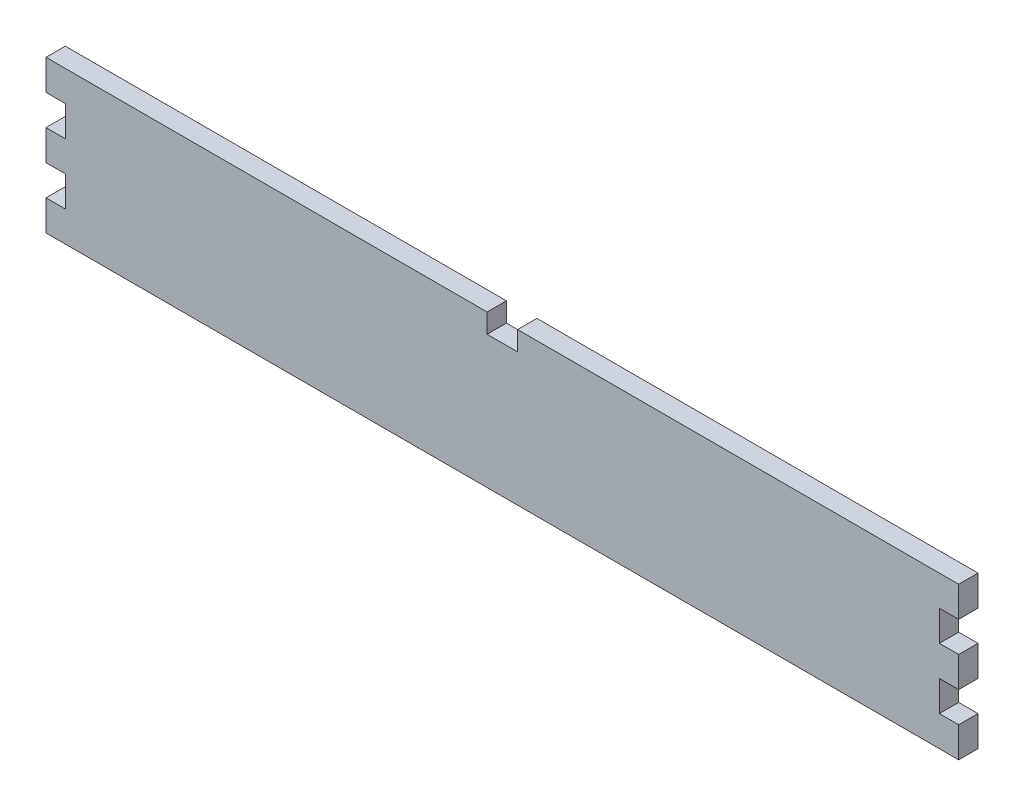
from build123d import *

# Parameters (mm, degrees)
BOSS_EXTRUDE1_OUTLINE_W = 50
BOSS_EXTRUDE1_OUTLINE_H = 6.35
BOSS_EXTRUDE1_DEPTH     = 300
SKETCH1_W               = 10
SKETCH1_H               = 6.35
F_250_TOOTH_DEPTH       = 305.204409074
SKETCH5_W               = 6.35
SKETCH5_H               = 10
F_3T_CUT_DEPTH          = 305.204409074


# Read off the part's stored shape, not the designer's step: Boss-Extrude1
with BuildPart() as part:
    # Boss-Extrude1 outline → Boss-Extrude1 (new body)
    with BuildSketch(Plane.YZ):
        with Locations((25, 3.175)):
            Rectangle(BOSS_EXTRUDE1_OUTLINE_W, BOSS_EXTRUDE1_OUTLINE_H)
    extrude(amount=BOSS_EXTRUDE1_DEPTH)

    # Sketch1 → 250-tooth (cut, through all)
    with BuildSketch(Plane.XY.offset(6.35)):
        with Locations((150, 46.825)):
            Rectangle(SKETCH1_W, SKETCH1_H)
    extrude(amount=-F_250_TOOTH_DEPTH, mode=Mode.SUBTRACT)

    # Sketch5 → 3t_cut (cut, through all)
    with BuildSketch(Plane.XY.offset(6.35)):
        with Locations((3.175, 35)):
            Rectangle(SKETCH5_W, SKETCH5_H)
    f_3t_cut = extrude(amount=-F_3T_CUT_DEPTH, mode=Mode.SUBTRACT)

    # 3t_pattern: 3t_cut at 3 more places
    with Locations((0, -20, 0), (293.65, 0, 0), (293.65, -20, 0)):
        add(f_3t_cut, mode=Mode.SUBTRACT)


solid = part.part
